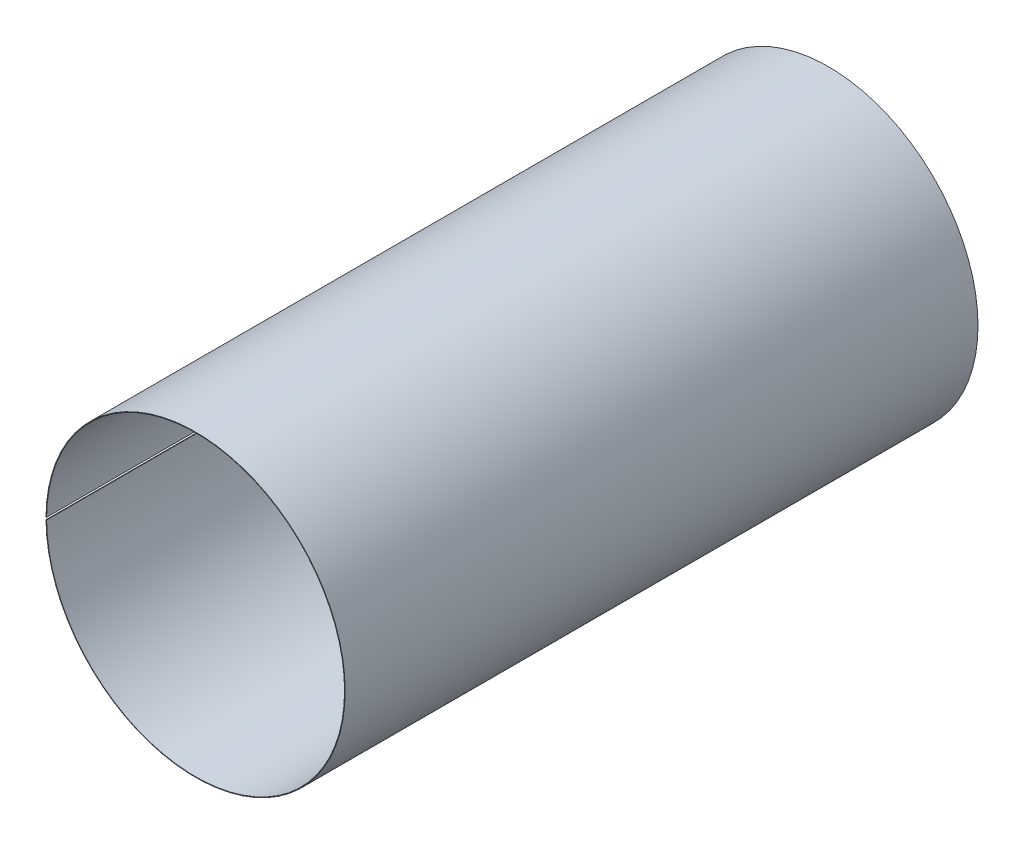
from build123d import *

# Parameters (mm, degrees)
SKETCH2_R               = 66.04
SKETCH2_R_2             = 65.786
BOSS_EXTRUDE1_DEPTH     = 279.4
CUT_EXTRUDE1_DEPTH      = 317.023366225
CUT_EXTRUDE1_DEPTH_BACK = 10.16
SKETCH5_W               = 279.4
SKETCH5_H               = 1.016


with BuildPart() as part:
    # Sketch2 → Boss-Extrude1 (new body)
    with BuildSketch(Plane.XY):
        Circle(SKETCH2_R)
        Circle(SKETCH2_R_2, mode=Mode.SUBTRACT)
    extrude(amount=BOSS_EXTRUDE1_DEPTH)

    # Sketch5 → Cut-Extrude1 (cut, two sides: drawn at the far end of the back side and taken through both)
    with BuildSketch(Plane.ZY.offset(66.04).offset(-CUT_EXTRUDE1_DEPTH_BACK)):
        with Locations((139.7, 0)):
            Rectangle(SKETCH5_W, SKETCH5_H)
    extrude(amount=CUT_EXTRUDE1_DEPTH + CUT_EXTRUDE1_DEPTH_BACK, mode=Mode.SUBTRACT)


solid = part.part
